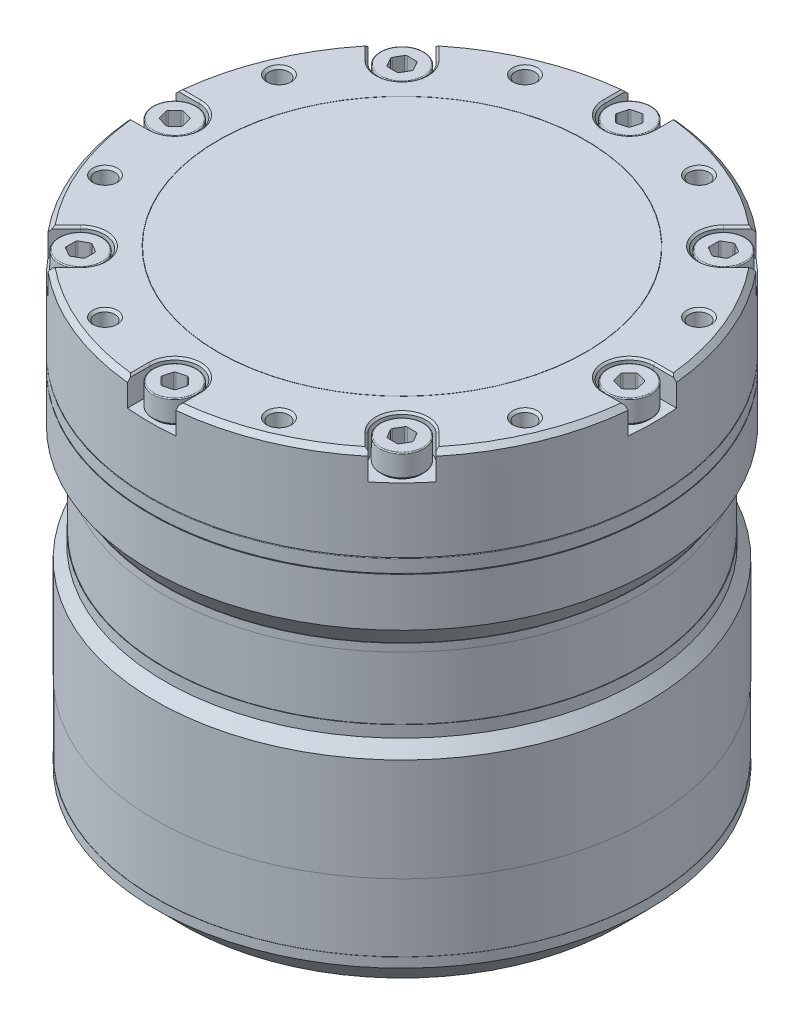
from build123d import *

# Parameters (mm, degrees)
SKETCH_1_R                           = 26.000000000000007
EXTRUDE_1_DEPTH                      = 1.5
FILLET_1_R                           = 0.1
SKETCH_2_R                           = 26
EXTRUDE_2_DEPTH                      = 9.5
CHAMFER_3_SIZE                       = 0.5
SKETCH_4_R                           = 1.35
CUT_EXTRUDE_1_DEPTH                  = 39.379682260279345
CUT_EXTRUDE_2_DEPTH                  = 2.8
CHAMFER_1_SIZE                       = 0.2
SKETCH_6_R                           = 2.0000000000000004
EXTRUDE_3_DEPTH                      = 0.5
SKETCH_7_R                           = 2.2499999999999996
EXTRUDE_4_DEPTH                      = 2
CHAMFER_2_SIZE                       = 0.5
FILLET_2_R                           = 0.1
CUT_EXTRUDE_3_DEPTH                  = 1.8
SKETCH_9_R                           = 1.0000000000000033
CUT_EXTRUDE_4_DEPTH                  = 39.379682260279345
HOLE_WIZARD_M2_5_1_D                 = 2.05
HOLE_WIZARD_M2_5_1_CSINK_D           = 2.55
HOLE_WIZARD_M2_5_1_CSINK_ANGLE       = 90
PATTERN_CIRCULAR_1_COUNT             = 8
CHAMFER_1_OF_PATTERN_CIRCULAR_1_SIZE = 0.2
CHAMFER_2_OF_PATTERN_CIRCULAR_1_SIZE = 0.5
FILLET_2_OF_PATTERN_CIRCULAR_1_R     = 0.1
SKETCH_13_R                          = 19
SKETCH_13_R_2                        = 18.975
CUT_EXTRUDE_5_DEPTH                  = 2
EXTRUDE_START                        = 5
SKETCH_14_R                          = 26
EXTRUDE_5_DEPTH                      = 5
SKETCH_17_R                          = 24.5
EXTRUDE_6_DEPTH                      = 0.8
SKETCH_18_R                          = 24.45
EXTRUDE_7_DEPTH                      = 6.5
SKETCH_19_R                          = 24.5
EXTRUDE_8_DEPTH                      = 1.2
SKETCH_21_R                          = 25.5
EXTRUDE_9_DEPTH                      = 10.64
SKETCH_22_R                          = 25.475000000000005
EXTRUDE_10_DEPTH                     = 7
SKETCH_23_R                          = 25.5
EXTRUDE_11_DEPTH                     = 4
CHAMFER_4_SIZE                       = 3


with BuildPart() as part:
    # 草图1 → 凸台-拉伸1 (new body)
    with BuildSketch(Plane(origin=(0, 0, 0), x_dir=(1, 0, 0), z_dir=(0, 1, 0))):
        with Locations(Location((0, 0, 0), (0, 0, 270))):
            Circle(SKETCH_1_R)
    extrude(amount=EXTRUDE_1_DEPTH)

    # 圆角1
    fillet_1_edges = [part.edges().sort_by_distance(p)[0] for p in [
        (7.96e-15, 0, -26.000000000000007),
        (7.96e-15, 1.5, -26.000000000000007),
    ]]
    fillet(fillet_1_edges, radius=FILLET_1_R)

    # 草图2 → 凸台-拉伸2 (add)
    with BuildSketch(Plane(origin=(0, 1.5, 0), x_dir=(1, 0, 0), z_dir=(0, 1, 0))):
        with Locations(Location((0, 0, 0), (0, 0, 270))):
            Circle(SKETCH_2_R)
    extrude(amount=EXTRUDE_2_DEPTH)

    # 倒角3
    chamfer_3_edges = [part.edges().sort_by_distance(p)[0] for p in [
        (-3.59e-15, 11, -26),
    ]]
    chamfer(chamfer_3_edges, length=CHAMFER_3_SIZE)

    # 草图4 → 切除-拉伸1 (cut, symmetric)
    with BuildSketch(Plane(origin=(0, 11, 0), x_dir=(1, 0, 0), z_dir=(0, 1, 0))):
        with Locations(Location((1e-17, 23.5, 0), (0, 0, 270))):
            Circle(SKETCH_4_R)
    cut_extrude_1 = extrude(amount=CUT_EXTRUDE_1_DEPTH, both=True, mode=Mode.SUBTRACT)

    # 草图5 → 切除-拉伸2 (cut)
    with BuildSketch(Plane(origin=(0, 11, 0), x_dir=(1, 0, 0), z_dir=(0, 1, 0))):
        with BuildLine():
            Line((-2.5, 23.5), (-2.5, 26.000000000000004))
            Line((-2.5, 26.000000000000004), (2.5, 26.000000000000004))
            Line((2.5, 26.000000000000004), (2.5, 23.5))
            ThreePointArc((2.5, 23.5), (2e-17, 21.000000000000004), (-2.5, 23.5))
        make_face()
    cut_extrude_2 = extrude(amount=-CUT_EXTRUDE_2_DEPTH, mode=Mode.SUBTRACT)

    # 倒角1
    chamfer_1_edges = [part.edges().sort_by_distance(p)[0] for p in [
        (-2.5, 11, -24.43857754044949),
        (2.5, 11, -24.43857754044949),
        (1.5e-16, 11, -21),
    ]]
    chamfer(chamfer_1_edges, length=CHAMFER_1_SIZE)

    # 草图6 → 凸台-拉伸3 (add)
    with BuildSketch(Plane(origin=(0, 8.2, 0), x_dir=(1, 0, 0), z_dir=(0, 1, 0))):
        with Locations(Location((1e-17, 23.5, 0), (0, 0, 270))):
            Circle(SKETCH_6_R)
    extrude_3 = extrude(amount=EXTRUDE_3_DEPTH)

    # 草图7 → 凸台-拉伸4 (add)
    with BuildSketch(Plane(origin=(0, 8.7, 0), x_dir=(1, 0, 0), z_dir=(0, 1, 0))):
        with Locations(Location((1e-17, 23.5, 0), (0, 0, 270))):
            Circle(SKETCH_7_R)
    extrude_4 = extrude(amount=EXTRUDE_4_DEPTH)

    # 倒角2
    # the kernel refuses this chamfer: 0.5 mm, written as the material it adds along each edge
    with BuildSketch(Plane(origin=(1e-17, 8.7, -23.5), x_dir=(-1.8e-16, 0, 1), z_dir=(-1, 0, -1.8e-16))) as chamfer_2_piece_1_section:
        Polygon((2 + CHAMFER_2_SIZE, 0), (2, -CHAMFER_2_SIZE), (2, 0), align=None)
    chamfer_2_piece_1 = revolve(axis=Axis((1e-17, 8.7, -23.5), (0, 1, 0)), mode=Mode.PRIVATE)
    chamfer_2_piece_1 = chamfer_2_piece_1 & Plane(origin=(1e-17, 8.325747447307968, -23.5), x_dir=(-1.8e-16, 0, 1), z_dir=(0, -1, 0)) * Cylinder(2.2499999999999996, 10, mode=Mode.PRIVATE)
    add(chamfer_2_piece_1)

    # 圆角2
    fillet_2_edges = [part.edges().sort_by_distance(p)[0] for p in [
        (7e-16, 10.7, -25.75),
        (-5.5e-16, 8.45, -25.75),
    ]]
    fillet(fillet_2_edges, radius=FILLET_2_R)

    # 草图8 → 切除-拉伸3 (cut)
    with BuildSketch(Plane(origin=(0, 10.7, 0), x_dir=(1, 0, 0), z_dir=(0, 1, 0))):
        with BuildLine():
            Line((0.8425087626005592, 22.790413981060354), (1.0864788843867326, 23.681375210861617))
            ThreePointArc((1.0864788843867326, 23.681375210861617), (1.0870458906796379, 23.784901276183874), (1.0357738998722739, 23.874840981853254))
            Line((1.0357738998722739, 23.874840981853254), (0.3861639019704516, 24.53160591998509))
            ThreePointArc((0.3861639019704516, 24.53160591998509), (0.29679120259398123, 24.58385999449999), (0.19326513727172098, 24.584427000792893))
            Line((0.19326513727172098, 24.584427000792893), (-0.7003149824162843, 24.350230709123476))
            ThreePointArc((-0.7003149824162843, 24.350230709123476), (-0.790254688085665, 24.29895871831611), (-0.842508762600557, 24.20958601893964))
            Line((-0.842508762600557, 24.20958601893964), (-1.0864788843867332, 23.318624789138376))
            ThreePointArc((-1.0864788843867332, 23.318624789138376), (-1.0870458906796416, 23.215098723816116), (-1.035773899872276, 23.125159018146736))
            Line((-1.035773899872276, 23.125159018146736), (-0.38616390197044614, 22.4683940800149))
            ThreePointArc((-0.38616390197044614, 22.4683940800149), (-0.2967912025939757, 22.416140005500004), (-0.19326513727171554, 22.415572999207097))
            Line((-0.19326513727171554, 22.415572999207097), (0.7003149824162865, 22.649769290876517))
            ThreePointArc((0.7003149824162865, 22.649769290876517), (0.790254688085662, 22.70104128168389), (0.8425087626005592, 22.790413981060354))
        make_face()
    cut_extrude_3 = extrude(amount=-CUT_EXTRUDE_3_DEPTH, mode=Mode.SUBTRACT)

    # 草图9 → 切除-拉伸4 (cut, symmetric)
    with BuildSketch(Plane(origin=(0, 11, 0), x_dir=(1, 0, 0), z_dir=(0, 1, 0))):
        with Locations(Location((-8.993060660579479, 21.711169014015294, 0), (0, 0, 270))):
            Circle(SKETCH_9_R)
    cut_extrude_4 = extrude(amount=CUT_EXTRUDE_4_DEPTH, both=True, mode=Mode.SUBTRACT)

    # M2.5 螺纹孔1 (through all)
    with Locations(Plane(origin=(0, 11, 0), x_dir=(1, 0, 0), z_dir=(0, 1, 0))):
        with Locations((-8.993060661, 21.711169014)):
            hole_wizard_m2_5_1 = CounterSinkHole(HOLE_WIZARD_M2_5_1_D / 2, HOLE_WIZARD_M2_5_1_CSINK_D / 2, counter_sink_angle=HOLE_WIZARD_M2_5_1_CSINK_ANGLE)

    # 阵列(圆周)1: 切除-拉伸1, 切除-拉伸2, 凸台-拉伸3, 凸台-拉伸4, 切除-拉伸3, 切除-拉伸4, M2.5 螺纹孔1 ×8 about axis
    pattern_circular_1_axis = Axis((1.533e-14, 0, -6.4e-16), (0, 1, 0))
    add([cut_extrude_1.rotate(pattern_circular_1_axis, i * 360 / PATTERN_CIRCULAR_1_COUNT) for i in range(1, PATTERN_CIRCULAR_1_COUNT)], mode=Mode.SUBTRACT)
    add([cut_extrude_2.rotate(pattern_circular_1_axis, i * 360 / PATTERN_CIRCULAR_1_COUNT) for i in range(1, PATTERN_CIRCULAR_1_COUNT)], mode=Mode.SUBTRACT)
    add([extrude_3.rotate(pattern_circular_1_axis, i * 360 / PATTERN_CIRCULAR_1_COUNT) for i in range(1, PATTERN_CIRCULAR_1_COUNT)])
    add([extrude_4.rotate(pattern_circular_1_axis, i * 360 / PATTERN_CIRCULAR_1_COUNT) for i in range(1, PATTERN_CIRCULAR_1_COUNT)])
    add([cut_extrude_3.rotate(pattern_circular_1_axis, i * 360 / PATTERN_CIRCULAR_1_COUNT) for i in range(1, PATTERN_CIRCULAR_1_COUNT)], mode=Mode.SUBTRACT)
    add([cut_extrude_4.rotate(pattern_circular_1_axis, i * 360 / PATTERN_CIRCULAR_1_COUNT) for i in range(1, PATTERN_CIRCULAR_1_COUNT)], mode=Mode.SUBTRACT)
    add([hole_wizard_m2_5_1.rotate(pattern_circular_1_axis, i * 360 / PATTERN_CIRCULAR_1_COUNT) for i in range(1, PATTERN_CIRCULAR_1_COUNT)], mode=Mode.SUBTRACT)

    # 倒角1 of 阵列(圆周)1
    chamfer_1_of_pattern_circular_1_edges = [part.edges().sort_by_distance(p)[0] for p in [
        (-19.048450854371456, 11, -15.512916948438715),
        (-15.512916948438717, 11, -19.048450854371453),
        (-14.849242404917492, 11, -14.849242404917488),
        (-24.438577540449476, 11, 2.5000000000000133),
        (-24.438577540449476, 11, -2.4999999999999867),
        (-20.999999999999986, 11, 1.325e-14),
        (-15.512916948438699, 11, 19.04845085437147),
        (-19.04845085437144, 11, 15.51291694843873),
        (-14.849242404917472, 11, 14.849242404917506),
        (2.5000000000000275, 11, 24.43857754044949),
        (-2.4999999999999725, 11, 24.43857754044949),
        (2.794e-14, 11, 21),
        (19.048450854371485, 11, 15.512916948438717),
        (15.512916948438747, 11, 19.048450854371456),
        (14.849242404917522, 11, 14.849242404917488),
        (24.438577540449504, 11, -2.5000000000000115),
        (24.438577540449504, 11, 2.4999999999999885),
        (21.000000000000014, 11, -1.196e-14),
        (15.512916948438733, 11, -19.048450854371467),
        (19.04845085437147, 11, -15.512916948438729),
        (14.849242404917504, 11, -14.849242404917504),
    ]]
    chamfer(chamfer_1_of_pattern_circular_1_edges, length=CHAMFER_1_OF_PATTERN_CIRCULAR_1_SIZE)

    # 倒角2 of 阵列(圆周)1
    # the kernel refuses this chamfer: 0.5 mm, written as the material it adds along each edge
    with BuildSketch(Plane(origin=(-16.617009357883862, 8.7, -16.61700935788386), x_dir=(0.7071067811865476, 0, 0.7071067811865476), z_dir=(-0.7071067811865476, 0, 0.7071067811865476))) as chamfer_2_of_pattern_circular_1_piece_1_section:
        Polygon((2.0000000000000013, -CHAMFER_2_OF_PATTERN_CIRCULAR_1_SIZE), (2.0000000000000036 + CHAMFER_2_OF_PATTERN_CIRCULAR_1_SIZE, 0), (2.0000000000000036, 0), align=None)
    chamfer_2_of_pattern_circular_1_piece_1 = revolve(axis=Axis((-16.617009357883862, 8.7, -16.61700935788386), (0, 1, 0)), mode=Mode.PRIVATE)
    chamfer_2_of_pattern_circular_1_piece_1 = chamfer_2_of_pattern_circular_1_piece_1 & Plane(origin=(-16.617009357883862, 8.325747447307966, -16.61700935788386), x_dir=(0.7071067811865474, 0, 0.7071067811865477), z_dir=(0, -1, 0)) * Cylinder(2.2499999999999996, 11, mode=Mode.PRIVATE)
    add(chamfer_2_of_pattern_circular_1_piece_1)
    with BuildSketch(Plane(origin=(-23.499999999999986, 8.7, 1.207e-14), x_dir=(1, 0, 2.9e-16), z_dir=(-2.9e-16, 0, 1))) as chamfer_2_of_pattern_circular_1_piece_2_section:
        Polygon((2, -CHAMFER_2_OF_PATTERN_CIRCULAR_1_SIZE), (2 + CHAMFER_2_OF_PATTERN_CIRCULAR_1_SIZE, 0), (2, 0), align=None)
    chamfer_2_of_pattern_circular_1_piece_2 = revolve(axis=Axis((-23.499999999999986, 8.7, 1.207e-14), (0, 1, 0)), mode=Mode.PRIVATE)
    chamfer_2_of_pattern_circular_1_piece_2 = chamfer_2_of_pattern_circular_1_piece_2 & Plane(origin=(-23.499999999999986, 8.325747447307968, 1.207e-14), x_dir=(1, 0, 2.9e-16), z_dir=(0, -1, 0)) * Cylinder(2.2499999999999996, 10, mode=Mode.PRIVATE)
    add(chamfer_2_of_pattern_circular_1_piece_2)
    with BuildSketch(Plane(origin=(-16.617009357883845, 8.7, 16.617009357883877), x_dir=(0.7071067811865479, 0, -0.707106781186547), z_dir=(0.707106781186547, 0, 0.7071067811865479))) as chamfer_2_of_pattern_circular_1_piece_3_section:
        Polygon((2.000000000000001, -CHAMFER_2_OF_PATTERN_CIRCULAR_1_SIZE), (2.0000000000000044 + CHAMFER_2_OF_PATTERN_CIRCULAR_1_SIZE, 0), (2.0000000000000044, 0), align=None)
    chamfer_2_of_pattern_circular_1_piece_3 = revolve(axis=Axis((-16.617009357883845, 8.7, 16.617009357883877), (0, 1, 0)), mode=Mode.PRIVATE)
    chamfer_2_of_pattern_circular_1_piece_3 = chamfer_2_of_pattern_circular_1_piece_3 & Plane(origin=(-16.617009357883845, 8.325747447307966, 16.617009357883877), x_dir=(0.7071067811865477, 0, -0.7071067811865474), z_dir=(0, -1, 0)) * Cylinder(2.2499999999999996, 11, mode=Mode.PRIVATE)
    add(chamfer_2_of_pattern_circular_1_piece_3)
    with BuildSketch(Plane(origin=(2.777e-14, 8.7, 23.5), x_dir=(3.1e-16, 0, -1), z_dir=(1, 0, 3.1e-16))) as chamfer_2_of_pattern_circular_1_piece_4_section:
        Polygon((2, -CHAMFER_2_OF_PATTERN_CIRCULAR_1_SIZE), (2 + CHAMFER_2_OF_PATTERN_CIRCULAR_1_SIZE, 0), (2, 0), align=None)
    chamfer_2_of_pattern_circular_1_piece_4 = revolve(axis=Axis((2.777e-14, 8.7, 23.5), (0, 1, 0)), mode=Mode.PRIVATE)
    chamfer_2_of_pattern_circular_1_piece_4 = chamfer_2_of_pattern_circular_1_piece_4 & Plane(origin=(2.777e-14, 8.325747447307968, 23.5), x_dir=(3.1e-16, 0, -1), z_dir=(0, -1, 0)) * Cylinder(2.2499999999999996, 10, mode=Mode.PRIVATE)
    add(chamfer_2_of_pattern_circular_1_piece_4)
    with BuildSketch(Plane(origin=(16.61700935788389, 8.7, 16.61700935788386), x_dir=(-0.7071067811865476, 0, -0.7071067811865476), z_dir=(0.7071067811865476, 0, -0.7071067811865476))) as chamfer_2_of_pattern_circular_1_piece_5_section:
        Polygon((2.0000000000000013, -CHAMFER_2_OF_PATTERN_CIRCULAR_1_SIZE), (2.0000000000000013 + CHAMFER_2_OF_PATTERN_CIRCULAR_1_SIZE, 0), (2.0000000000000013, 0), align=None)
    chamfer_2_of_pattern_circular_1_piece_5 = revolve(axis=Axis((16.61700935788389, 8.7, 16.61700935788386), (0, 1, 0)), mode=Mode.PRIVATE)
    chamfer_2_of_pattern_circular_1_piece_5 = chamfer_2_of_pattern_circular_1_piece_5 & Plane(origin=(16.61700935788389, 8.325747447307966, 16.61700935788386), x_dir=(-0.7071067811865474, 0, -0.7071067811865478), z_dir=(0, -1, 0)) * Cylinder(2.2499999999999996, 11, mode=Mode.PRIVATE)
    add(chamfer_2_of_pattern_circular_1_piece_5)
    with BuildSketch(Plane(origin=(23.500000000000014, 8.7, -1.074e-14), x_dir=(-1, 0, -4.1e-16), z_dir=(4.1e-16, 0, -1))) as chamfer_2_of_pattern_circular_1_piece_6_section:
        Polygon((2, -CHAMFER_2_OF_PATTERN_CIRCULAR_1_SIZE), (2 + CHAMFER_2_OF_PATTERN_CIRCULAR_1_SIZE, 0), (2, 0), align=None)
    chamfer_2_of_pattern_circular_1_piece_6 = revolve(axis=Axis((23.500000000000014, 8.7, -1.074e-14), (0, 1, 0)), mode=Mode.PRIVATE)
    chamfer_2_of_pattern_circular_1_piece_6 = chamfer_2_of_pattern_circular_1_piece_6 & Plane(origin=(23.500000000000014, 8.325747447307968, -1.074e-14), x_dir=(-1, 0, -4.1e-16), z_dir=(0, -1, 0)) * Cylinder(2.2499999999999996, 10, mode=Mode.PRIVATE)
    add(chamfer_2_of_pattern_circular_1_piece_6)
    with BuildSketch(Plane(origin=(16.617009357883873, 8.7, -16.617009357883873), x_dir=(-0.7071067811865476, 0, 0.7071067811865476), z_dir=(-0.7071067811865476, 0, -0.7071067811865476))) as chamfer_2_of_pattern_circular_1_piece_7_section:
        Polygon((2, -CHAMFER_2_OF_PATTERN_CIRCULAR_1_SIZE), (1.9999999999999987 + CHAMFER_2_OF_PATTERN_CIRCULAR_1_SIZE, 0), (1.9999999999999987, 0), align=None)
    chamfer_2_of_pattern_circular_1_piece_7 = revolve(axis=Axis((16.617009357883873, 8.7, -16.617009357883873), (0, 1, 0)), mode=Mode.PRIVATE)
    chamfer_2_of_pattern_circular_1_piece_7 = chamfer_2_of_pattern_circular_1_piece_7 & Plane(origin=(16.617009357883873, 8.325747447307966, -16.617009357883873), x_dir=(-0.7071067811865478, 0, 0.7071067811865472), z_dir=(0, -1, 0)) * Cylinder(2.2499999999999996, 10, mode=Mode.PRIVATE)
    add(chamfer_2_of_pattern_circular_1_piece_7)

    # 圆角2 of 阵列(圆周)1
    fillet_2_of_pattern_circular_1_edges = [part.edges().sort_by_distance(p)[0] for p in [
        (-18.207999615553593, 10.7, -18.20799961555359),
        (-18.207999615553593, 8.45, -18.20799961555359),
        (-25.749999999999986, 10.7, 1.241e-14),
        (-25.749999999999986, 8.45, 1.366e-14),
        (-18.207999615553575, 10.7, 18.207999615553607),
        (-18.207999615553575, 8.45, 18.207999615553607),
        (2.681e-14, 10.7, 25.75),
        (2.806e-14, 8.45, 25.75),
        (18.20799961555362, 10.7, 18.207999615553593),
        (18.20799961555362, 8.45, 18.207999615553593),
        (25.750000000000014, 10.7, -1.054e-14),
        (25.750000000000014, 8.45, -1.179e-14),
        (18.207999615553607, 10.7, -18.207999615553604),
        (18.207999615553607, 8.45, -18.207999615553604),
    ]]
    fillet(fillet_2_of_pattern_circular_1_edges, radius=FILLET_2_OF_PATTERN_CIRCULAR_1_R)

    # 草图13 → 切除-拉伸5 (cut)
    with BuildSketch(Plane(origin=(0, 11, 0), x_dir=(1, 0, 0), z_dir=(0, 1, 0))):
        with Locations(Location((0, 0, 0), (0, 0, 270))):
            Circle(SKETCH_13_R)
        with Locations(Location((0, 0, 0), (0, 0, 270))):
            Circle(SKETCH_13_R_2, mode=Mode.SUBTRACT)
    extrude(amount=-CUT_EXTRUDE_5_DEPTH, mode=Mode.SUBTRACT)

    # 草图14 → 凸台-拉伸5 (add)
    with BuildSketch(Plane.XZ.offset(EXTRUDE_START)):
        with Locations(Location((0, 0, 0), (0, 0, 90))):
            Circle(SKETCH_14_R)
    extrude(amount=-EXTRUDE_5_DEPTH)

    # 草图15 → 旋转1 (revolve)
    with BuildSketch(Plane.XY, mode=Mode.PRIVATE) as revolve_1_sk:
        Polygon((26.000000000000004, -5), (24.45, -7.213629410450259), (0, -7.213629410450257), (0, -5.000000000000004), align=None)
    revolve(revolve_1_sk.sketch.rotate(Axis((0, 0, 0), (0, 1, 0)), 90), axis=Axis((0, 0, 0), (0, 1, 0)))

    # 草图17 → 凸台-拉伸6 (add)
    with BuildSketch(Plane.XZ.offset(7.213629410450258)):
        with Locations(Location((0, 0, 0), (0, 0, 270))):
            Circle(SKETCH_17_R)
    extrude(amount=EXTRUDE_6_DEPTH)

    # 草图18 → 凸台-拉伸7 (add)
    with BuildSketch(Plane.XZ.offset(8.013629410450259)):
        with Locations(Location((0, 0, 0), (0, 0, 90))):
            Circle(SKETCH_18_R)
    extrude(amount=EXTRUDE_7_DEPTH)

    # 草图19 → 凸台-拉伸8 (add)
    with BuildSketch(Plane.XZ.offset(14.513629410450257)):
        with Locations(Location((0, 0, 0), (0, 0, 270))):
            Circle(SKETCH_19_R)
    extrude(amount=EXTRUDE_8_DEPTH)


with BuildPart() as body_2:
    # 草图20 → 旋转2 (revolve)
    with BuildSketch(Plane.XY, mode=Mode.PRIVATE) as revolve_2_sk:
        Polygon((1.96e-15, -15.217938091751648), (24.450000000000003, -15.713629410450256), (25.500000000000004, -16.964970682674164), (2.02e-15, -16.96497068267417), align=None)
    revolve(revolve_2_sk.sketch.rotate(Axis((0, -5.3e-16, 0), (1.3e-16, -1, 0)), 264.482265626), axis=Axis((0, -5.3e-16, 0), (1.3e-16, -1, 0)))

    # 草图21 → 凸台-拉伸9 (add)
    with BuildSketch(Plane.XZ.offset(16.96497068267417)):
        Circle(SKETCH_21_R)
    extrude(amount=EXTRUDE_9_DEPTH)

    # 草图22 → 凸台-拉伸10 (add)
    with BuildSketch(Plane.XZ.offset(27.60497068267417)):
        Circle(SKETCH_22_R)
    extrude(amount=EXTRUDE_10_DEPTH)

    # 草图23 → 凸台-拉伸11 (add)
    with BuildSketch(Plane.XZ.offset(34.60497068267417)):
        Circle(SKETCH_23_R)
    extrude(amount=EXTRUDE_11_DEPTH)

    # 倒角4
    chamfer_4_edges = [body_2.edges().sort_by_distance(p)[0] for p in [
        (-25.499999999999996, -38.60497068267417, 3.12e-15),
    ]]
    chamfer(chamfer_4_edges, length=CHAMFER_4_SIZE)


solid = Compound([part.part, body_2.part])
